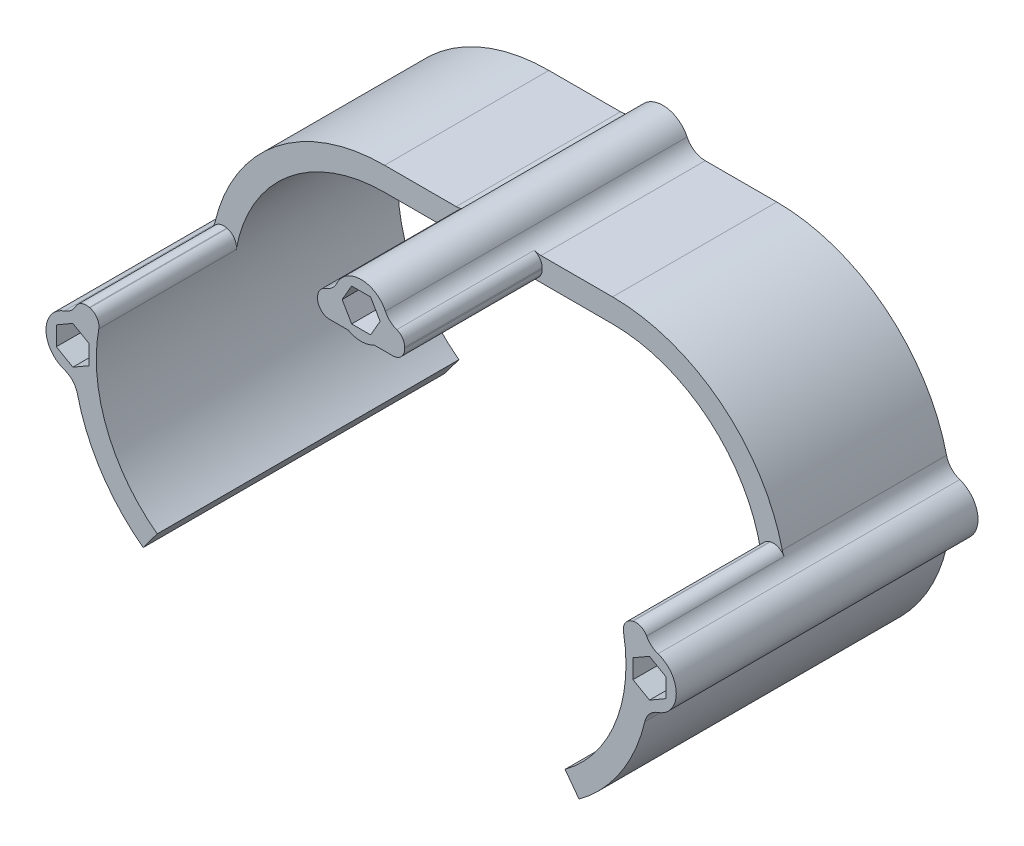
from build123d import *

# Parameters (mm, degrees)
EXTRUDE_1_DEPTH     = 45
CUT_EXTRUDE_START   = -20.5
CUT_EXTRUDE_1_DEPTH = 20.5
FILLET_1_R          = 1.8


with BuildPart() as part:
    # 草图2 → 凸台-拉伸1 (new body)
    with BuildSketch(Plane.XY):
        with BuildLine():
            Line((-17.000000000000004, 25.99999999999999), (-6.324555320336758, 25.999999999999996))
            ThreePointArc((-6.324555320336758, 25.999999999999996), (-4.720987868862212, 26.464537235814447), (-3.614031611621006, 27.71428571428571))
            ThreePointArc((-3.614031611621006, 27.71428571428571), (2.4e-16, 30), (3.614031611621006, 27.71428571428571))
            ThreePointArc((3.614031611621006, 27.71428571428571), (4.720987868862212, 26.464537235814447), (6.324555320336758, 25.999999999999996))
            Line((6.324555320336758, 25.999999999999996), (17.000000000000004, 25.99999999999999))
            ThreePointArc((17.000000000000004, 25.99999999999999), (33.14520180681835, 20.379707029717306), (42.310344827586206, 5.948650662854563))
            ThreePointArc((42.310344827586206, 5.948650662854563), (43.01263196777571, 4.615165346220191), (44.27472527472528, 3.7914476752259816))
            ThreePointArc((44.27472527472528, 3.7914476752259816), (47, -7.66e-15), (44.27472527472528, -3.791447675225999))
            ThreePointArc((44.27472527472528, -3.791447675225999), (43.01263196777571, -4.615165346220208), (42.310344827586206, -5.948650662854578))
            ThreePointArc((42.310344827586206, -5.948650662854578), (38.72710851162517, -14.280502642556568), (32.5, -20.874625745148098))
            Line((32.5, -20.874625745148098), (30.413461538461537, -18.064579971762782))
            ThreePointArc((30.413461538461537, -18.064579971762782), (38.36238574416096, 7.063885284860494), (17.000000000000007, 22.500000000000004))
            Line((17.000000000000007, 22.500000000000004), (1.9364916731037032, 22.499999999999996))
            ThreePointArc((1.9364916731037032, 22.499999999999996), (2.4e-16, 22), (-1.9364916731037032, 22.499999999999996))
            Line((-1.9364916731037032, 22.499999999999996), (-17.000000000000004, 22.500000000000004))
            ThreePointArc((-17.000000000000004, 22.500000000000004), (-38.36238574416096, 7.063885284860502), (-30.413461538461544, -18.064579971762775))
            Line((-30.413461538461544, -18.064579971762775), (-32.5, -20.874625745148098))
            ThreePointArc((-32.5, -20.874625745148098), (-38.727108511625175, -14.280502642556563), (-42.310344827586206, -5.948650662854575))
            ThreePointArc((-42.310344827586206, -5.948650662854575), (-43.01263196777571, -4.615165346220205), (-44.27472527472528, -3.7914476752259954))
            ThreePointArc((-44.27472527472528, -3.7914476752259954), (-46.99999999999999, -3.62e-15), (-44.27472527472527, 3.791447675225978))
            ThreePointArc((-44.27472527472527, 3.791447675225978), (-43.012631967775704, 4.615165346220189), (-42.310344827586206, 5.9486506628545595))
            ThreePointArc((-42.310344827586206, 5.9486506628545595), (-33.14520180681835, 20.379707029717306), (-17.000000000000004, 25.99999999999999))
        make_face()
        Polygon((1.414508159514589, 28.45), (-1.4145081595145819, 28.45), (-2.829016319029165, 26.000000000000004), (-1.4145081595145819, 23.549999999999997), (1.4145081595145816, 23.549999999999997), (2.829016319029169, 26.000000000000004), align=None, mode=Mode.SUBTRACT)
        Polygon((-43, -2.8290163190291664), (-45.44999999999999, -1.414508159514586), (-45.44999999999999, 1.4145081595145663), (-43, 2.8290163190291495), (-40.55, 1.4145081595145712), (-40.55, -1.414508159514584), align=None, mode=Mode.SUBTRACT)
        Polygon((45.44999999999999, -1.414508159514587), (45.44999999999999, 1.4145081595145672), (43, 2.8290163190291513), (40.55, 1.414508159514572), (40.55, -1.414508159514585), (43, -2.829016319029168), align=None, mode=Mode.SUBTRACT)
    extrude(amount=EXTRUDE_1_DEPTH)

    # 草图3 → 切除-拉伸1 (cut)
    with BuildSketch(Plane.XY.offset(45).offset(CUT_EXTRUDE_START)):
        with BuildLine():
            Line((-42.16101815897212, 6.551577306563255), (-38.773958022187415, 5.669634207602821))
            ThreePointArc((-38.773958022187415, 5.669634207602821), (-30.76014589909817, 17.801920818707508), (-17.000000000000004, 22.5))
            Line((-17.000000000000004, 22.5), (-6.499999999999999, 22.5))
            Line((-6.499999999999999, 22.5), (-6.500000000000001, 25.999999999999986))
            Line((-6.500000000000001, 25.999999999999986), (-17.000000000000004, 25.999999999999993))
            ThreePointArc((-17.000000000000004, 25.999999999999993), (-32.900613038957886, 20.57110850161755), (-42.16101815897212, 6.551577306563255))
        make_face()
        with BuildLine():
            Line((42.16101815897216, 6.551577306563108), (38.77395802218746, 5.669634207602693))
            ThreePointArc((38.77395802218746, 5.669634207602693), (30.760145899098227, 17.80192081870747), (17.000000000000007, 22.5))
            Line((17.000000000000007, 22.5), (6.500000000000001, 22.5))
            Line((6.500000000000001, 22.5), (6.500000000000003, 25.999999999999986))
            Line((6.500000000000003, 25.999999999999986), (17, 25.99999999999999))
            ThreePointArc((17, 25.99999999999999), (32.90061303895794, 20.57110850161751), (42.16101815897216, 6.551577306563108))
        make_face()
    extrude(amount=CUT_EXTRUDE_1_DEPTH, mode=Mode.SUBTRACT)

    # 圆角1
    # the kernel refuses this fillet: 1.8 mm, written as the material it takes off along each edge
    with BuildSketch(Plane(origin=(-6.499999999999999, 22.5, 24.5), x_dir=(-4.9e-16, 1, 0), z_dir=(0, 0, 1))) as fillet_1_piece_1:
        with BuildLine():
            CenterArc((FILLET_1_R, -FILLET_1_R), FILLET_1_R, 89.99999999999997, 89.99999999999997)
            Line((-4.44e-15, -FILLET_1_R), (0, 0))
            Line((0, 0), (FILLET_1_R, 0))
        make_face()
    extrude(amount=25, mode=Mode.SUBTRACT)
    with BuildSketch(Plane(origin=(-6.500000000000001, 25.999999999999986, 24.5), x_dir=(0.9891271990467642, 0.14706251767837725, 0), z_dir=(0, 0, 1))) as fillet_1_piece_2:
        with BuildLine():
            CenterArc((1.5573753123133534, -1.7649481565014509), FILLET_1_R, 101.3256751198377, 70.21759155918191)
            Line((-0.22305364597082192, -1.5002356246803719), (-0.4010965417992392, -1.473764371498264))
            Line((-0.4010965417992392, -1.473764371498264), (-0.17804289582841726, 0.02647125318210786))
            Line((-0.17804289582841726, 0.02647125318210786), (0.02647125318210786, 0.17804289582841726))
            ThreePointArc((0.02647125318210786, 0.17804289582841726), (0.2000083577650695, 0.15224155952387494), (1.168531917251559, 0.17649481565014538))
            Line((1.168531917251559, 0.17649481565014538), (1.203881316802631, -2e-17))
        make_face()
    extrude(amount=24.291816730260194, mode=Mode.SUBTRACT)
    with BuildSketch(Plane(origin=(6.500000000000001, 22.5, 24.5), x_dir=(-1, -1.97e-15, 0), z_dir=(0, 0, 1))) as fillet_1_piece_3:
        with BuildLine():
            CenterArc((FILLET_1_R, -FILLET_1_R), FILLET_1_R, 89.99999999999993, 89.99999999999996)
            Line((-4.44e-15, -FILLET_1_R), (0, 0))
            Line((0, 0), (FILLET_1_R, 0))
        make_face()
    extrude(amount=25, mode=Mode.SUBTRACT)
    with BuildSketch(Plane(origin=(6.500000000000003, 25.999999999999986, 24.5), x_dir=(-0.9891271990467642, 0.14706251767837714, 0), z_dir=(0, 0, 1))) as fillet_1_piece_4:
        with BuildLine():
            CenterArc((1.5573753123133545, 1.7649481565014509), FILLET_1_R, 188.4567333209804, 70.21759155918187)
            Line((-0.22305364597082086, 1.5002356246803719), (-0.40109654179923815, 1.4737643714982642))
            Line((-0.40109654179923815, 1.4737643714982642), (-0.17804289582841726, -0.02647125318210784))
            Line((-0.17804289582841726, -0.02647125318210784), (0.02647125318210784, -0.17804289582841726))
            ThreePointArc((0.02647125318210784, -0.17804289582841726), (0.20000835776506773, -0.15224155952387522), (1.1685319172515596, -0.17649481565014538))
            Line((1.1685319172515596, -0.17649481565014538), (1.2038813168026317, 2e-17))
        make_face()
    extrude(amount=24.291816730260194, mode=Mode.SUBTRACT)
    with BuildSketch(Plane(origin=(38.77395802218746, 5.669634207602693, 24.5), x_dir=(0.2159440686633983, -0.9764057349325113, 0), z_dir=(0, 0, 1))) as fillet_1_piece_5:
        with BuildLine():
            CenterArc((1.7345250396355076, 1.7987633090933175), FILLET_1_R, 182.12401133336417, 85.75197733327184)
            Line((-0.06423826945781225, 1.7320508075688776), (0, 0))
            ThreePointArc((0, 0), (0.8339062690555353, 0.01545863633349137), (1.6678125381110727, -6e-17))
        make_face()
    extrude(amount=24.83310408026317, mode=Mode.SUBTRACT)
    with BuildSketch(Plane(origin=(42.16101815897217, 6.551577306563109, 24.5), x_dir=(0.30232503982893916, -0.9532048941819542, 0), z_dir=(0, 0, 1))) as fillet_1_piece_6:
        with BuildLine():
            CenterArc((1.7095969183976014, -1.770799573138055), FILLET_1_R, 100.33438988529196, 76.6632370150231)
            Line((-0.08793234080970554, -1.6765204010286838), (-0.267685266730436, -1.667092483817746))
            Line((-0.267685266730436, -1.667092483817746), (-0.17975292592072528, 0.00942791721106288))
            Line((-0.17975292592072528, 0.00942791721106288), (0.00942791721106515, 0.17975292592072362))
            ThreePointArc((0.00942791721106515, 0.17975292592072362), (0.633577059222906, 0.1395355017085772), (1.3543993186778904, 0.1770799573138067))
            Line((1.3543993186778904, 0.1770799573138067), (1.3866900095614998, -3e-17))
        make_face()
    extrude(amount=24.697062031666952, mode=Mode.SUBTRACT)
    with BuildSketch(Plane(origin=(-38.773958022187415, 5.669634207602822, 24.5), x_dir=(-0.21594406866341104, -0.9764057349325085, 0), z_dir=(0, 0, 1))) as fillet_1_piece_7:
        with BuildLine():
            CenterArc((1.7345250396355227, -1.7987633090933188), FILLET_1_R, 92.12401133336449, 85.75197733327163)
            Line((-0.06423826945779765, -1.7320508075688876), (0, 0))
            ThreePointArc((0, 0), (0.8339062690555384, -0.01545863633350171), (1.6678125381110729, 3e-17))
        make_face()
    extrude(amount=24.833104080263197, mode=Mode.SUBTRACT)
    with BuildSketch(Plane(origin=(-42.16101815897213, 6.5515773065632565, 24.5), x_dir=(-0.30232503982891934, -0.9532048941819604, 0), z_dir=(0, 0, 1))) as fillet_1_piece_8:
        with BuildLine():
            CenterArc((1.7095969183976452, 1.770799573138059), FILLET_1_R, 183.00237309968935, 76.66323701501943)
            Line((-0.08793234080965445, 1.676520401028549), (-0.26768526673038506, 1.6670924838176002))
            Line((-0.26768526673038506, 1.6670924838176002), (-0.17975292592072462, -0.00942791721105888))
            Line((-0.17975292592072462, -0.00942791721105888), (0.00942791721106057, -0.1797529259207241))
            ThreePointArc((0.00942791721106057, -0.1797529259207241), (0.6335770592230675, -0.13953550170858298), (1.3543993186779588, -0.1770799573138045))
            Line((1.3543993186779588, -0.1770799573138045), (1.3866900095615668, 2e-17))
        make_face()
    extrude(amount=24.697062031666604, mode=Mode.SUBTRACT)


solid = part.part
